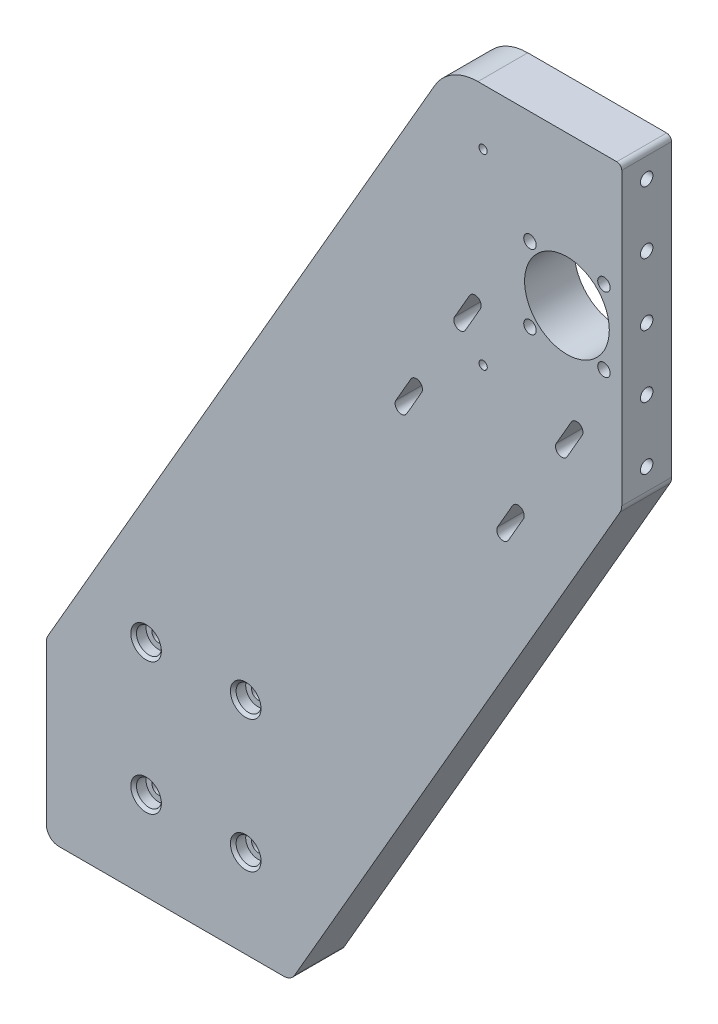
from build123d import *

# Parameters (mm, degrees)
SCHIZZO1_R                    = 17
SCHIZZO1_R_2                  = 2.5
ESTRUSIONE_ESTRUSIONE2_DEPTH  = 20
M5_TAPPED_HOLE1_D             = 4.2
M5_TAPPED_HOLE1_DEPTH         = 17.4
M5_TAPPED_HOLE1_TIP           = 1.2618073
CBORE_FOR_M5_SHCS1_AT_2_COUNT = 2
CBORE_FOR_M5_SHCS1_AT_2_PITCH = 53
CBORE_FOR_M5_SHCS1_AT_3_COUNT = 2
CBORE_FOR_M5_SHCS1_AT_3_PITCH = 66.400301204
CBORE_FOR_M5_SHCS1_AT_4_COUNT = 2
CBORE_FOR_M5_SHCS1_AT_4_PITCH = 40
M6_TAPPED_HOLE1_D             = 5
M6_TAPPED_HOLE1_DEPTH         = 19
M6_TAPPED_HOLE1_TIP           = 1.502151548
M4_TAPPED_HOLE1_D             = 3.3
CUT_EXTRUDE2_DEPTH            = 420.801540473


with BuildPart() as part:
    # Schizzo1 → Estrusione-Estrusione2 (new body)
    with BuildSketch(Plane.XY):
        with BuildLine():
            Line((5, 0), (95.262794416, 0))
            ThreePointArc((95.262794416, 0), (97.762794416, 0.669872981), (99.592921435, 2.5))
            Line((99.592921435, 2.5), (230.270234695, 228.839745962))
            ThreePointArc((230.270234695, 228.839745962), (230.769736807, 230.045650737), (230.940107676, 231.339745962))
            Line((230.940107676, 231.339745962), (230.940107676, 348))
            ThreePointArc((230.940107676, 348), (230.354321238, 349.414213562), (228.940107676, 350))
            Line((228.940107676, 350), (173.205080757, 350))
            ThreePointArc((173.205080757, 350), (163.205080757, 347.320508076), (155.884572681, 340))
            Line((155.884572681, 340), (0.669872981, 71.160254038))
            ThreePointArc((0.669872981, 71.160254038), (0.170370869, 69.954349263), (0, 68.660254038))
            Line((0, 68.660254038), (0, 5))
            ThreePointArc((0, 5), (1.464466094, 1.464466094), (5, 0))
        make_face()
        with Locations((208.940107676, 290)):
            Circle(SCHIZZO1_R, mode=Mode.SUBTRACT)
        with Locations((223.789350081, 304.849242405)):
            Circle(SCHIZZO1_R_2, mode=Mode.SUBTRACT)
        with Locations((223.789350081, 275.150757595)):
            Circle(SCHIZZO1_R_2, mode=Mode.SUBTRACT)
        with Locations((194.090865271, 275.150757595)):
            Circle(SCHIZZO1_R_2, mode=Mode.SUBTRACT)
        with Locations((194.090865271, 304.849242405)):
            Circle(SCHIZZO1_R_2, mode=Mode.SUBTRACT)
    extrude(amount=-ESTRUSIONE_ESTRUSIONE2_DEPTH)

    # M5 Tapped Hole1
    with Locations(Plane(origin=(50.131397208, 0, -10), x_dir=(0, 0, -1), z_dir=(0, -1, 0))):
        with Locations((0, 0), (0, 35), (0, -35)):
            Hole(M5_TAPPED_HOLE1_D / 2, depth=M5_TAPPED_HOLE1_DEPTH)
            with Locations((0, 0, -(M5_TAPPED_HOLE1_DEPTH + M5_TAPPED_HOLE1_TIP / 2))):  # 118° drill point
                Cone(0, M5_TAPPED_HOLE1_D / 2, M5_TAPPED_HOLE1_TIP, mode=Mode.SUBTRACT)

    # Sketch5 → CBORE for M5 SHCS1 (revolve, cut)
    with BuildSketch(Plane(origin=(80, 88.5, 0), x_dir=(0, -1, 0), z_dir=(1, 0, 0))):
        Polygon((0, 0), (0, 20), (2.65, 20), (2.65, 5), (5, 5), (5, 1.145), (6.145, 0), align=None)
    cbore_for_m5_shcs1 = revolve(axis=Axis((80, 88.5, 6.35), (0, 0, -1)), mode=Mode.SUBTRACT)

    # CBORE for M5 SHCS1 at 2: CBORE for M5 SHCS1 ×2
    with Locations(*[(0, -i * CBORE_FOR_M5_SHCS1_AT_2_PITCH, 0) for i in range(1, CBORE_FOR_M5_SHCS1_AT_2_COUNT)]):
        add(cbore_for_m5_shcs1, mode=Mode.SUBTRACT)

    # CBORE for M5 SHCS1 at 3: CBORE for M5 SHCS1 ×2
    with Locations(*[Vector(-0.6024069059118463, -0.7981891503332503, 0) * (i * CBORE_FOR_M5_SHCS1_AT_3_PITCH) for i in range(1, CBORE_FOR_M5_SHCS1_AT_3_COUNT)]):
        add(cbore_for_m5_shcs1, mode=Mode.SUBTRACT)

    # CBORE for M5 SHCS1 at 4: CBORE for M5 SHCS1 ×2
    with Locations(*[(-i * CBORE_FOR_M5_SHCS1_AT_4_PITCH, 0, 0) for i in range(1, CBORE_FOR_M5_SHCS1_AT_4_COUNT)]):
        add(cbore_for_m5_shcs1, mode=Mode.SUBTRACT)

    # M6 Tapped Hole1
    with Locations(Plane(origin=(230.940107676, 340, -10), x_dir=(0, 0, 1), z_dir=(1, 0, 0))):
        with Locations((0, 0), (0, 25), (0, 50), (0, 75), (0, 100)):
            Hole(M6_TAPPED_HOLE1_D / 2, depth=M6_TAPPED_HOLE1_DEPTH)
            with Locations((0, 0, -(M6_TAPPED_HOLE1_DEPTH + M6_TAPPED_HOLE1_TIP / 2))):  # 118° drill point
                Cone(0, M6_TAPPED_HOLE1_D / 2, M6_TAPPED_HOLE1_TIP, mode=Mode.SUBTRACT)

    # M4 Tapped Hole1 (through all)
    with Locations(Plane(origin=(175.288579616, 327.50684833, 0), x_dir=(1, 0, 0), z_dir=(0, 0, 1))):
        with Locations((0, 0), (0.024506359, -75.035669595)):
            Hole(M4_TAPPED_HOLE1_D / 2)

    # Sketch18 → Cut-Extrude2 (cut, through all)
    with BuildSketch(Plane.XY):
        with BuildLine():
            Line((163.860199555, 263.569403781), (169.860199555, 273.961708627))
            ThreePointArc((169.860199555, 273.961708627), (173.275263065, 274.876772136), (174.190326574, 271.461708627))
            Line((174.190326574, 271.461708627), (168.190326574, 261.069403781))
            ThreePointArc((168.190326574, 261.069403781), (164.775263065, 260.154340272), (163.860199555, 263.569403781))
        make_face()
        with BuildLine():
            Line((204.685071052, 239.999153209), (210.685071052, 250.391458055))
            ThreePointArc((210.685071052, 250.391458055), (214.100134561, 251.306521564), (215.015198071, 247.891458055))
            Line((215.015198071, 247.891458055), (209.015198071, 237.499153209))
            ThreePointArc((209.015198071, 237.499153209), (205.600134561, 236.5840897), (204.685071052, 239.999153209))
        make_face()
        with BuildLine():
            Line((181.115071052, 199.174715675), (187.115071052, 209.56702052))
            ThreePointArc((187.115071052, 209.56702052), (190.530134561, 210.48208403), (191.445198071, 207.06702052))
            Line((191.445198071, 207.06702052), (185.445198071, 196.674715675))
            ThreePointArc((185.445198071, 196.674715675), (182.030134561, 195.759652165), (181.115071052, 199.174715675))
        make_face()
        with BuildLine():
            Line((140.290633517, 222.744715675), (146.290633517, 233.13702052))
            ThreePointArc((146.290633517, 233.13702052), (149.705697027, 234.05208403), (150.620760536, 230.63702052))
            Line((150.620760536, 230.63702052), (144.620760536, 220.244715675))
            ThreePointArc((144.620760536, 220.244715675), (141.205697027, 219.329652165), (140.290633517, 222.744715675))
        make_face()
    extrude(amount=-CUT_EXTRUDE2_DEPTH, mode=Mode.SUBTRACT)


solid = part.part
